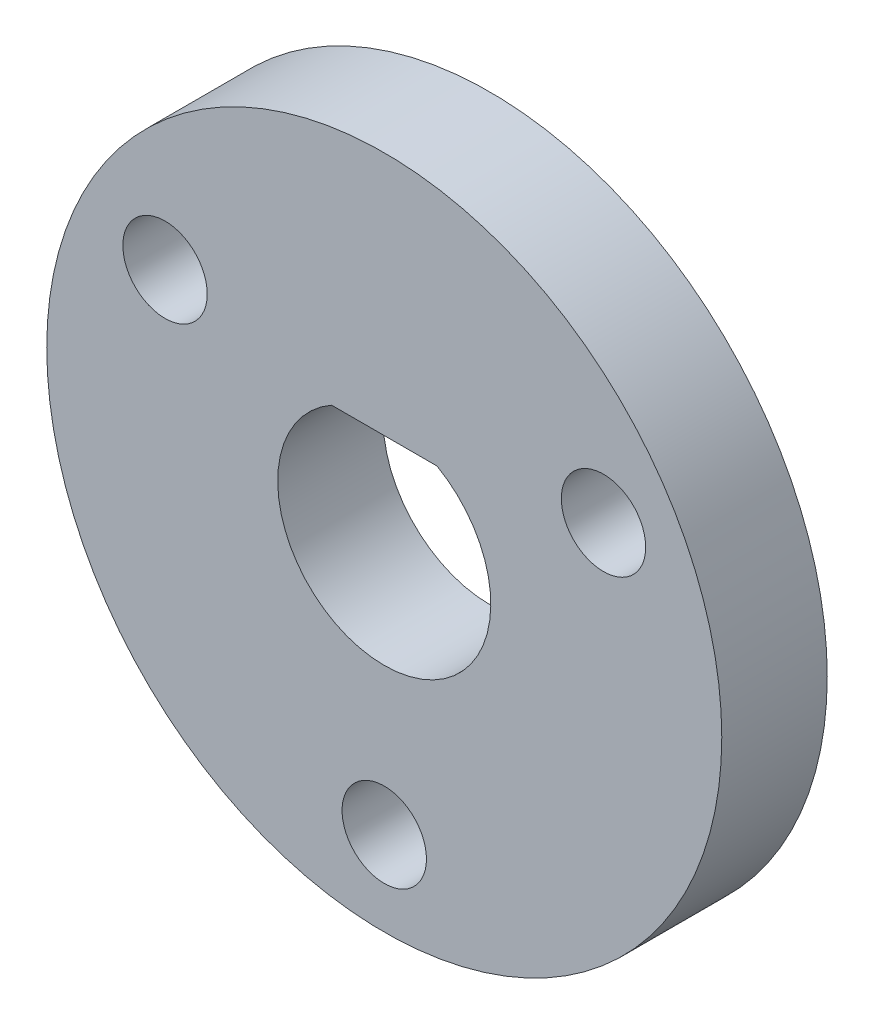
from build123d import *

# Parameters (mm, degrees)
SKETCH1_R            = 16
BOSS_EXTRUDE1_DEPTH  = 2.5
M4_CLEARANCE_HOLE2_D = 4
CIRPATTERN1_COUNT    = 3


with BuildPart() as part:
    # Sketch1 → Boss-Extrude1 (new, symmetric)
    with BuildSketch(Plane.XY):
        Circle(SKETCH1_R)
        with BuildLine():
            Line((-2.5, 4.387767086), (2.5, 4.387767086))
            ThreePointArc((2.5, 4.387767086), (0, -5.05), (-2.5, 4.387767086))
        make_face(mode=Mode.SUBTRACT)
    extrude(amount=BOSS_EXTRUDE1_DEPTH, both=True)

    # M4 Clearance Hole2 (through all)
    with Locations(Plane.XY.offset(2.5)):
        with Locations((0, -12)):
            m4_clearance_hole2 = Hole(M4_CLEARANCE_HOLE2_D / 2)

    # CirPattern1: M4 Clearance Hole2 ×3 about axis
    cirpattern1_axis = Axis((0, 0, 2.5), (0, 0, -1))
    for i in range(1, CIRPATTERN1_COUNT):
        add(m4_clearance_hole2.rotate(cirpattern1_axis, i * 360 / CIRPATTERN1_COUNT), mode=Mode.SUBTRACT)


solid = part.part
